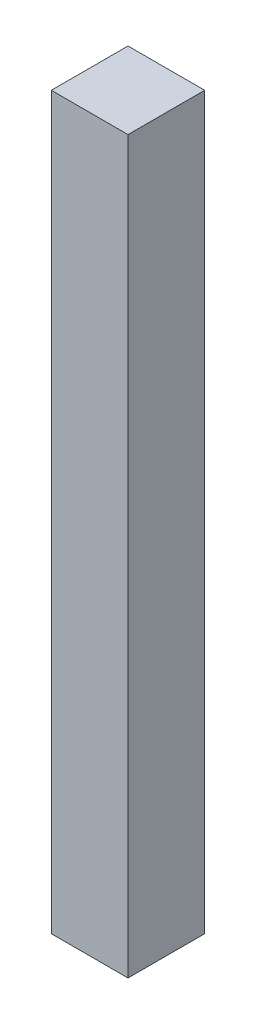
from build123d import *

# Parameters (mm, degrees)
SKETCH1_W           = 6.3
SKETCH1_H           = 6.3
BOSS_EXTRUDE1_DEPTH = 60


with BuildPart() as part:
    # Sketch1 → Boss-Extrude1 (new body)
    with BuildSketch(Plane(origin=(0, 0, 0), x_dir=(1, 0, 0), z_dir=(0, 1, 0))):
        Rectangle(SKETCH1_W, SKETCH1_H)
    extrude(amount=BOSS_EXTRUDE1_DEPTH)


solid = part.part
